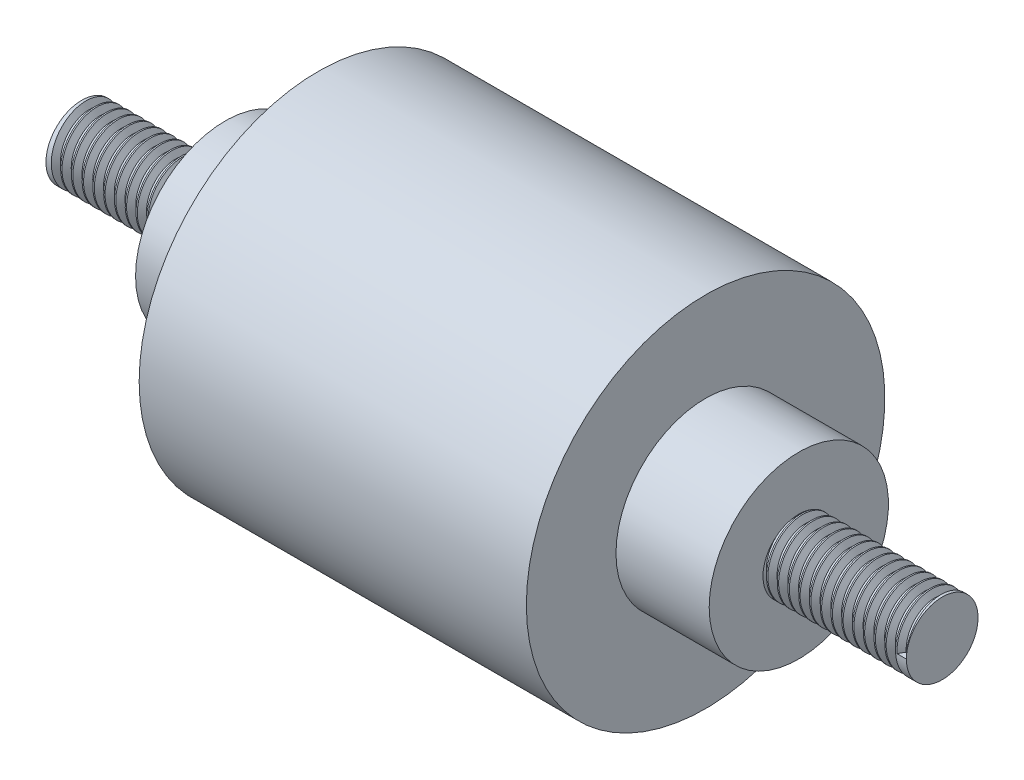
from build123d import *

# Parameters (mm, degrees)
SKETCH2_R           = 5
BOSS_EXTRUDE1_DEPTH = 20
THREAD1_PITCH       = 1.5
THREAD2_PITCH       = 1.5
SKETCH10_R          = 6.665166827
CUT_EXTRUDE1_DEPTH  = 70.641941989


with BuildPart() as part:
    # Sketch1 → Revolve1 (revolve)
    with BuildSketch(Plane.XY, mode=Mode.PRIVATE) as revolve1_sk:
        Polygon((-40, 0), (-40, 12.5), (-27, 12.5), (-27, 25), (27, 25), (27, 12.5), (40, 12.5), (40, 0), align=None)
    revolve(revolve1_sk.sketch.rotate(Axis((-40, 0, 0), (1, 0, 0)), 90), axis=Axis((-40, 0, 0), (1, 0, 0)))

    # Sketch2 → Boss-Extrude1 (add)
    with BuildSketch(Plane(origin=(40, 0, 0), x_dir=(0, 0, -1), z_dir=(1, 0, 0))):
        Circle(SKETCH2_R)
    boss_extrude1 = extrude(amount=BOSS_EXTRUDE1_DEPTH)

    # Thread1: arcs per turn and ends read off the stored shape
    # Thread1: the profile of Thread Profile1 profile screwed along a right-hand helix through 13.333333 turns, 8 arcs to a turn; built about Z, then put on its axis
    thread1_z = Axis((0, 0, 0), (0, 0, 1))
    thread1_corners = [(5.0003, 0, -0.000173205), (5.0003, 0, 1.312673201), (4.188101188, 0, 0.843749998), (4.188101188, 0, 0.468749998)]
    with BuildLine(mode=Mode.PRIVATE) as thread1_profile:
        Line(thread1_corners[0], thread1_corners[1])
        Line(thread1_corners[1], thread1_corners[2])
        Line(thread1_corners[2], thread1_corners[3])
        Line(thread1_corners[3], thread1_corners[0])
    thread1_cap = Face(thread1_profile.wire())
    thread1_turn_angles = [0, 22.5, 45, 67.5, 90, 112.5, 135, 157.5, 180, 202.5, 225, 247.5, 270, 292.5, 315, 337.5, 360]
    thread1_turn_weights = [1, 0.9238795325112867, 1, 0.9238795325112867, 1, 0.9238795325112867, 1, 0.9238795325112867, 1, 0.9238795325112867, 1, 0.9238795325112867, 1, 0.9238795325112867, 1, 0.9238795325112867, 1]
    thread1_turn_rails = [Edge.make_bspline([Vector(p[0], p[1], 0).rotate(thread1_z, thread1_turn_angles[k]) / thread1_turn_weights[k] + Vector(0, 0, p[2] + THREAD1_PITCH * thread1_turn_angles[k] / 360) for k in range(17)], [0, 0, 0, 1, 1, 2, 2, 3, 3, 4, 4, 5, 5, 6, 6, 7, 7, 8, 8, 8], 2, thread1_turn_weights) for p in thread1_corners]
    thread1_turn_sides = [Face.make_surface_from_curves(thread1_turn_rails[p[0]], thread1_turn_rails[p[1]]) for p in [(0, 1), (1, 2), (2, 3), (3, 0)]]
    thread1_last_angles = [4680, 4702.5, 4725, 4747.5, 4770, 4785, 4800]
    thread1_last_weights = [1, 0.9238795325112867, 1, 0.9238795325112867, 1, 0.9659258262890683, 1]
    thread1_last_rails = [Edge.make_bspline([Vector(p[0], p[1], 0).rotate(thread1_z, thread1_last_angles[k]) / thread1_last_weights[k] + Vector(0, 0, p[2] + THREAD1_PITCH * thread1_last_angles[k] / 360) for k in range(7)], [0, 0, 0, 1, 1, 2, 2, 3, 3, 3], 2, thread1_last_weights) for p in thread1_corners]
    thread1_last_sides = [Face.make_surface_from_curves(thread1_last_rails[p[0]], thread1_last_rails[p[1]]) for p in [(0, 1), (1, 2), (2, 3), (3, 0)]]
    thread1 = Plane(origin=(60, 0, 0), x_dir=(0, 0, 1), z_dir=(-1, 0, 0)) * Solid(Shell([*[p.moved(Location((0, 0, THREAD1_PITCH * i))) for i in range(13) for p in thread1_turn_sides], *thread1_last_sides, thread1_cap, thread1_cap.rotate(thread1_z, 4800).moved(Location((0, 0, THREAD1_PITCH * 4800 / 360)))]))
    add(thread1, mode=Mode.SUBTRACT)

    # Mirror3: Boss-Extrude1 across plane
    add(boss_extrude1.mirror(Plane(origin=(0, 0, 0), x_dir=(0, 0, 1), z_dir=(1, 0, 0))))

    # Thread2: arcs per turn and ends read off the stored shape
    # Thread2: the profile of Thread Profile2 profile screwed along a right-hand helix through 13.333333 turns, 8 arcs to a turn; built about Z, then put on its axis
    thread2_z = Axis((0, 0, 0), (0, 0, 1))
    thread2_corners = [(5.0003, 0, -0.000173205), (5.0003, 0, 1.312673201), (4.188101188, 0, 0.843749998), (4.188101188, 0, 0.468749998)]
    with BuildLine(mode=Mode.PRIVATE) as thread2_profile:
        Line(thread2_corners[0], thread2_corners[1])
        Line(thread2_corners[1], thread2_corners[2])
        Line(thread2_corners[2], thread2_corners[3])
        Line(thread2_corners[3], thread2_corners[0])
    thread2_cap = Face(thread2_profile.wire())
    thread2_turn_angles = [0, 22.5, 45, 67.5, 90, 112.5, 135, 157.5, 180, 202.5, 225, 247.5, 270, 292.5, 315, 337.5, 360]
    thread2_turn_weights = [1, 0.9238795325112867, 1, 0.9238795325112867, 1, 0.9238795325112867, 1, 0.9238795325112867, 1, 0.9238795325112867, 1, 0.9238795325112867, 1, 0.9238795325112867, 1, 0.9238795325112867, 1]
    thread2_turn_rails = [Edge.make_bspline([Vector(p[0], p[1], 0).rotate(thread2_z, thread2_turn_angles[k]) / thread2_turn_weights[k] + Vector(0, 0, p[2] + THREAD2_PITCH * thread2_turn_angles[k] / 360) for k in range(17)], [0, 0, 0, 1, 1, 2, 2, 3, 3, 4, 4, 5, 5, 6, 6, 7, 7, 8, 8, 8], 2, thread2_turn_weights) for p in thread2_corners]
    thread2_turn_sides = [Face.make_surface_from_curves(thread2_turn_rails[p[0]], thread2_turn_rails[p[1]]) for p in [(0, 1), (1, 2), (2, 3), (3, 0)]]
    thread2_last_angles = [4680, 4702.5, 4725, 4747.5, 4770, 4785, 4800]
    thread2_last_weights = [1, 0.9238795325112867, 1, 0.9238795325112867, 1, 0.9659258262890683, 1]
    thread2_last_rails = [Edge.make_bspline([Vector(p[0], p[1], 0).rotate(thread2_z, thread2_last_angles[k]) / thread2_last_weights[k] + Vector(0, 0, p[2] + THREAD2_PITCH * thread2_last_angles[k] / 360) for k in range(7)], [0, 0, 0, 1, 1, 2, 2, 3, 3, 3], 2, thread2_last_weights) for p in thread2_corners]
    thread2_last_sides = [Face.make_surface_from_curves(thread2_last_rails[p[0]], thread2_last_rails[p[1]]) for p in [(0, 1), (1, 2), (2, 3), (3, 0)]]
    thread2 = Plane(origin=(-60, 0, 0), x_dir=(0, 0, -1), z_dir=(1, 0, 0)) * Solid(Shell([*[p.moved(Location((0, 0, THREAD2_PITCH * i))) for i in range(13) for p in thread2_turn_sides], *thread2_last_sides, thread2_cap, thread2_cap.rotate(thread2_z, 4800).moved(Location((0, 0, THREAD2_PITCH * 4800 / 360)))]))
    add(thread2, mode=Mode.SUBTRACT)

    # Sketch10 → Cut-Extrude1 (cut, through all)
    with BuildSketch(Plane(origin=(0, 0, 0), x_dir=(1, 0, 0), z_dir=(0, 1, 0))):
        with Locations(Location((0, 0, 0), (0, 0, 270))):
            Circle(SKETCH10_R)
    extrude(amount=-CUT_EXTRUDE1_DEPTH, mode=Mode.SUBTRACT)


solid = part.part
